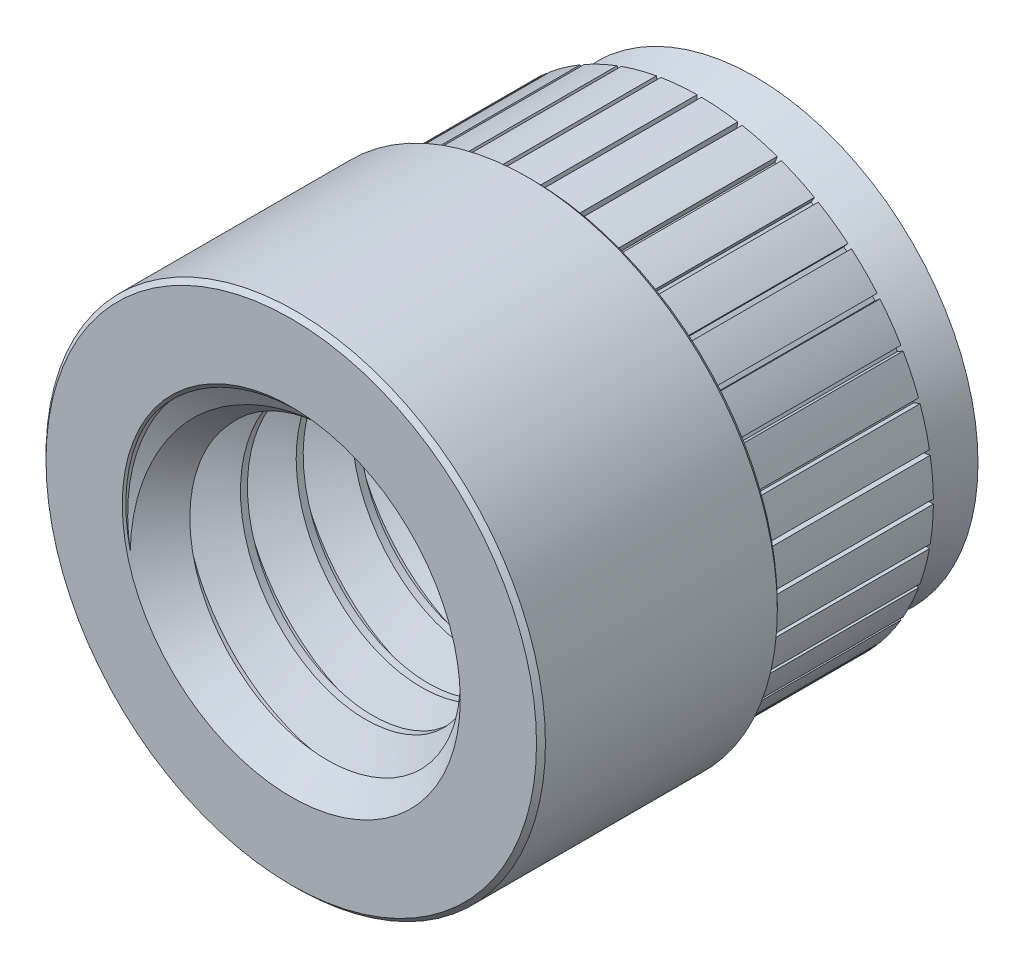
from build123d import *

# Parameters (mm, degrees)
SKETCH1_R               = 7.112
EXTRUDE1_DEPTH          = 6.858
SKETCH2_R               = 6.6675
EXTRUDE2_DEPTH          = 6.35
SKETCH3_W               = 0.127
SKETCH3_H               = 0.635
CUT_EXTRUDE_THIN1_DEPTH = 6.35
CIRPATTERN1_COUNT       = 36
SKETCH5_OUTSIDE_W       = 22.192
SKETCH5_OUTSIDE_H       = 22.192
SKETCH5_OUTSIDE_R       = 6.35
CUT_EXTRUDE1_DEPTH      = 1.5875
CUT_EXTRUDE1_DRAFT      = 20
CHAMFER2_SIZE           = 0.127
SKETCH7_R               = 4.7625
CUT_EXTRUDE3_DEPTH      = 17.601576793
SWEEP1_PITCH            = 1.5875
SKETCH10_R              = 7.112
CUT_EXTRUDE4_DEPTH      = 18.726826595
SKETCH11_R              = 6.35
CUT_EXTRUDE5_DEPTH      = 17.601576872


with BuildPart() as part:
    # Sketch1 → Extrude1 (new body)
    with BuildSketch(Plane.XY):
        Circle(SKETCH1_R)
    extrude(amount=-EXTRUDE1_DEPTH)

    # Sketch2 → Extrude2 (add)
    with BuildSketch(Plane(origin=(0, 0, -6.858), x_dir=(-1, 0, 0), z_dir=(0, 0, -1))):
        with Locations(Location((0, 0, 0), (0, 0, 180))):
            Circle(SKETCH2_R)
    extrude(amount=EXTRUDE2_DEPTH)

    # Sketch3 → Cut-Extrude-Thin1 (cut)
    with BuildSketch(Plane(origin=(0, 0, -13.208), x_dir=(-1, 0, 0), z_dir=(0, 0, -1))):
        with Locations((0, 6.7945)):
            Rectangle(SKETCH3_W, SKETCH3_H)
    cut_extrude_thin1 = extrude(amount=-CUT_EXTRUDE_THIN1_DEPTH, mode=Mode.SUBTRACT)

    # CirPattern1: Cut-Extrude-Thin1 ×36 about axis
    cirpattern1_axis = Axis((0, 0, 0), (0, 0, 1))
    for i in range(1, CIRPATTERN1_COUNT):
        add(cut_extrude_thin1.rotate(cirpattern1_axis, i * 360 / CIRPATTERN1_COUNT), mode=Mode.SUBTRACT)


with BuildPart() as cut_extrude1_tool:
    # Sketch5 outside → Cut-Extrude1 (with draft: the straight prism first)
    with BuildSketch(Plane(origin=(0, 0, -13.208), x_dir=(-1, 0, 0), z_dir=(0, 0, -1))):
        Rectangle(SKETCH5_OUTSIDE_W, SKETCH5_OUTSIDE_H)
        Circle(SKETCH5_OUTSIDE_R, mode=Mode.SUBTRACT)
    extrude(amount=-CUT_EXTRUDE1_DEPTH)
    # Cut-Extrude1: the draft: its side faces are tilted about the plane it starts from
    cut_extrude1_sides = [cut_extrude1_tool.faces().sort_by_distance(p)[0] for p in [
        (0, -11.096, -12.41425),
        (-11.096, 0, -12.41425),
        (0, 11.096, -12.41425),
        (11.096, 0, -12.41425),
        (6.35, 0, -12.41425),
    ]]
    draft(cut_extrude1_sides, Plane(origin=(0, 0, -13.208), x_dir=(-1, 0, 0), z_dir=(0, 0, -1)), CUT_EXTRUDE1_DRAFT)


with BuildPart() as part_1:
    add(part.part)

    # Cut-Extrude1: cut by cut_extrude1_tool
    add(cut_extrude1_tool.part, mode=Mode.SUBTRACT)

    # Chamfer2
    chamfer2_edges = [part_1.edges().sort_by_distance(p)[0] for p in [
        (-7.112, 0, 0),
        (-7.112, 0, -6.858),
    ]]
    chamfer(chamfer2_edges, length=CHAMFER2_SIZE)

    # Sketch7 → Cut-Extrude3 (cut, through all)
    with BuildSketch(Plane.XY):
        Circle(SKETCH7_R)
    extrude(amount=-CUT_EXTRUDE3_DEPTH, mode=Mode.SUBTRACT)

    # Sweep1: the profile of Sketch9 profile screwed along a right-hand helix of 10.32 turns, 6 arcs to a turn; built about Z, then put on its axis
    sweep1_z = Axis((0, 0, 0), (0, 0, 1))
    sweep1_corners = [(4.7628, 0, -1.389235705), (3.731388504, 0, -0.79375), (3.731388504, 0, -0.5953125), (4.7628, 0, 0.000173205)]
    with BuildLine(mode=Mode.PRIVATE) as sweep1_profile:
        Line(sweep1_corners[0], sweep1_corners[1])
        Line(sweep1_corners[1], sweep1_corners[2])
        Line(sweep1_corners[2], sweep1_corners[3])
        Line(sweep1_corners[3], sweep1_corners[0])
    sweep1_cap = Face(sweep1_profile.wire())
    sweep1_turn_angles = [0, 30, 60, 90, 120, 150, 180, 210, 240, 270, 300, 330, 360]
    sweep1_turn_weights = [1, 0.8660254037844387, 1, 0.8660254037844387, 1, 0.8660254037844387, 1, 0.8660254037844387, 1, 0.8660254037844387, 1, 0.8660254037844387, 1]
    sweep1_turn_rails = [Edge.make_bspline([Vector(p[0], p[1], 0).rotate(sweep1_z, sweep1_turn_angles[k]) / sweep1_turn_weights[k] + Vector(0, 0, p[2] + SWEEP1_PITCH * sweep1_turn_angles[k] / 360) for k in range(13)], [0, 0, 0, 1, 1, 2, 2, 3, 3, 4, 4, 5, 5, 6, 6, 6], 2, sweep1_turn_weights) for p in sweep1_corners]
    sweep1_turn_sides = [Face.make_surface_from_curves(sweep1_turn_rails[p[0]], sweep1_turn_rails[p[1]]) for p in [(0, 1), (1, 2), (2, 3), (3, 0)]]
    sweep1_last_angles = [3600, 3630, 3660, 3687.6, 3715.2]
    sweep1_last_weights = [1, 0.8660254037844387, 1, 0.8862035792311787, 1]
    sweep1_last_rails = [Edge.make_bspline([Vector(p[0], p[1], 0).rotate(sweep1_z, sweep1_last_angles[k]) / sweep1_last_weights[k] + Vector(0, 0, p[2] + SWEEP1_PITCH * sweep1_last_angles[k] / 360) for k in range(5)], [0, 0, 0, 1, 1, 2, 2, 2], 2, sweep1_last_weights) for p in sweep1_corners]
    sweep1_last_sides = [Face.make_surface_from_curves(sweep1_last_rails[p[0]], sweep1_last_rails[p[1]]) for p in [(0, 1), (1, 2), (2, 3), (3, 0)]]
    sweep1 = Plane(origin=(0, 0, -13.208), x_dir=(0, 1, 0), z_dir=(0, 0, 1)) * Solid(Shell([*[p.moved(Location((0, 0, SWEEP1_PITCH * i))) for i in range(10) for p in sweep1_turn_sides], *sweep1_last_sides, sweep1_cap, sweep1_cap.rotate(sweep1_z, 3715.2).moved(Location((0, 0, SWEEP1_PITCH * 3715.2 / 360)))]))
    add(sweep1)

    # Sketch10 → Cut-Extrude4 (cut, through all)
    with BuildSketch(Plane.XY):
        Circle(SKETCH10_R)
    extrude(amount=CUT_EXTRUDE4_DEPTH, mode=Mode.SUBTRACT)

    # Sketch11 → Cut-Extrude5 (cut, through all)
    with BuildSketch(Plane(origin=(0, 0, -13.208), x_dir=(-1, 0, 0), z_dir=(0, 0, -1))):
        Circle(SKETCH11_R)
    extrude(amount=CUT_EXTRUDE5_DEPTH, mode=Mode.SUBTRACT)

    # Cut-Extrude6 cone 1 section (through the dimple's axis) → Cut-Extrude6 (revolve, cut)
    with BuildSketch(Plane(origin=(0, 0, 0), x_dir=(0, -1, 0), z_dir=(1, 0, 0))):
        Polygon((0, 0), (4.8133, 0), (0, 4.8133), align=None)
    revolve(axis=Axis((0, 0, 0), (0, 0, -1)), mode=Mode.SUBTRACT)

    # Cut-Extrude7 cone 1 section (through the dimple's axis) → Cut-Extrude7 (revolve, cut)
    with BuildSketch(Plane(origin=(0, 0, -13.208), x_dir=(0, 1, 0), z_dir=(1, 0, 0))):
        Polygon((0, 0), (4.8133, 0), (0, 4.8133), align=None)
    revolve(axis=Axis((0, 0, -13.208), (0, 0, 1)), mode=Mode.SUBTRACT)


solid = part_1.part
